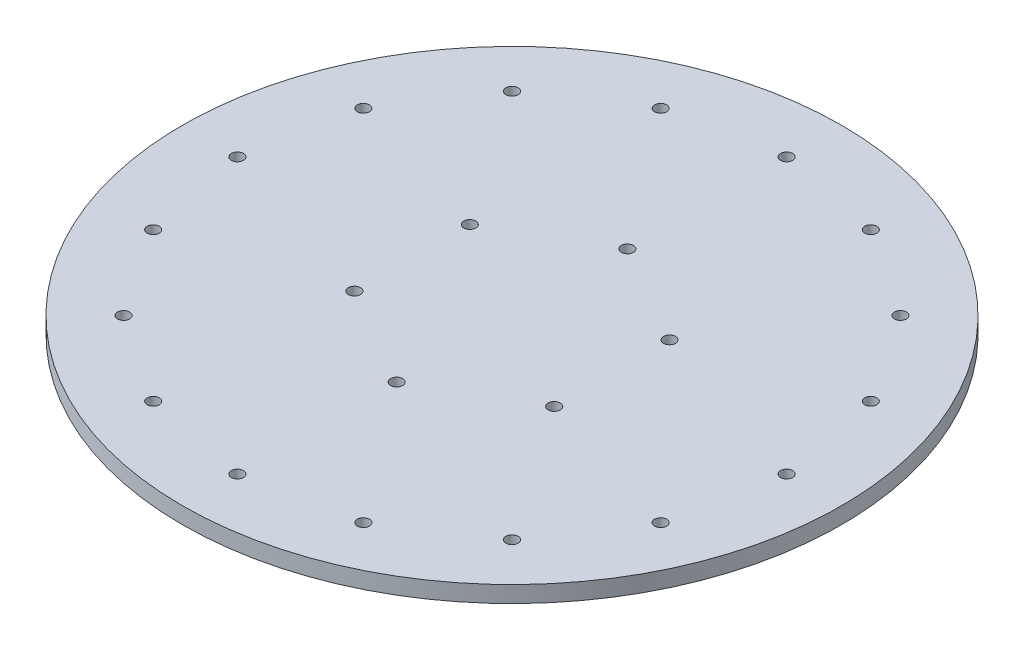
from build123d import *

# Parameters (mm, degrees)
SKETCH1_R                                = 300
BOSS_EXTRUDE1_DEPTH                      = 15
CBORE_FOR_M10_HEX_HEAD_BOLT1_D           = 11
CBORE_FOR_M10_HEX_HEAD_BOLT1_CBORE_D     = 21.48
CBORE_FOR_M10_HEX_HEAD_BOLT1_CBORE_DEPTH = 6.85


with BuildPart() as part:
    # Sketch1 → Boss-Extrude1 (new body)
    with BuildSketch(Plane(origin=(0, 0, 0), x_dir=(1, 0, 0), z_dir=(0, 1, 0))):
        Circle(SKETCH1_R)
    extrude(amount=BOSS_EXTRUDE1_DEPTH)

    # CBORE for M10 Hex Head Bolt1 (through all)
    with Locations(Plane.XZ):
        with Locations((0, -105), (90.932667397, -52.5), (0, -250), (90.932667397, 52.5), (0, 105), (-90.932667397, 52.5), (-90.932667397, -52.5), (95.670858091, -230.969883128), (176.776695297, -176.776695297), (230.969883128, -95.670858091), (250, 0), (230.969883128, 95.670858091), (176.776695297, 176.776695297), (95.670858091, 230.969883128), (0, 250), (-95.670858091, 230.969883128), (-176.776695297, 176.776695297), (-230.969883128, 95.670858091), (-250, 0), (-230.969883128, -95.670858091), (-176.776695297, -176.776695297), (-95.670858091, -230.969883128)):
            CounterBoreHole(CBORE_FOR_M10_HEX_HEAD_BOLT1_D / 2, CBORE_FOR_M10_HEX_HEAD_BOLT1_CBORE_D / 2, CBORE_FOR_M10_HEX_HEAD_BOLT1_CBORE_DEPTH)


solid = part.part
